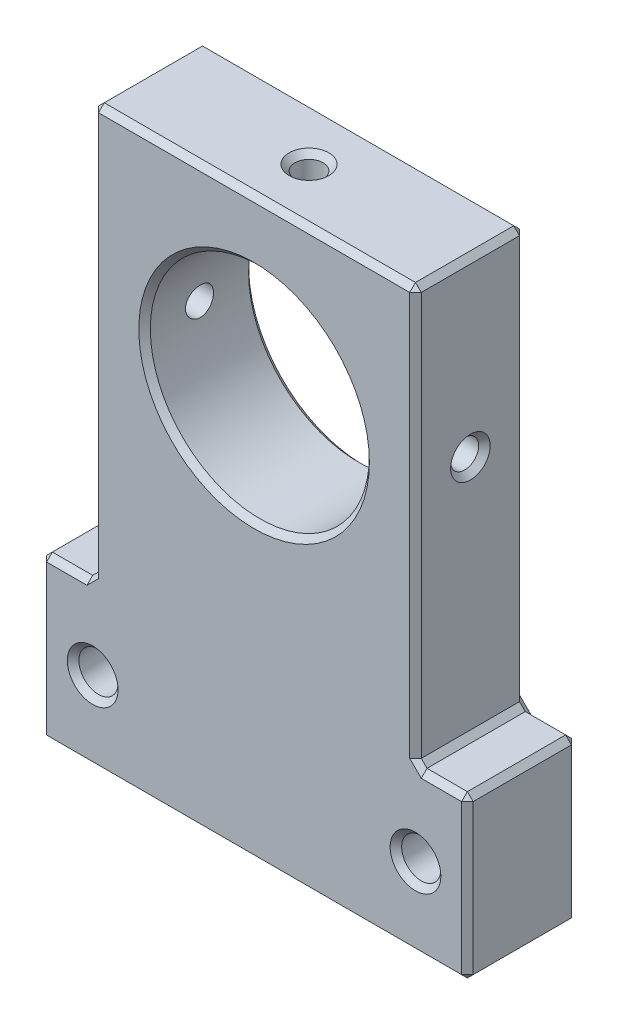
from build123d import *

# Parameters (mm, degrees)
SKETCH1_R               = 9.5
SKETCH1_R_2             = 1.7
BOSS_EXTRUDE1_DEPTH     = 9.525
SKETCH2_R               = 3.25
CUT_EXTRUDE1_DEPTH      = 5.5
SKETCH3_R               = 1.2195
CUT_EXTRUDE2_DEPTH      = 61.390194775
CUT_EXTRUDE3_REACH      = 64.926
CUT_EXTRUDE3_END_RADIUS = 9.5
SKETCH4_R               = 1.2195
CHAMFER1_SIZE           = 0.5
CHAMFER2_SIZE           = 0.5
CHAMFER3_SIZE           = 0.5
CHAMFER4_SIZE           = 0.5


with BuildPart() as part:
    # Sketch1 → Boss-Extrude1 (new body)
    with BuildSketch(Plane(origin=(0, 0, 0), x_dir=(-1, 0, 0), z_dir=(0, 0, 1))):
        Polygon((-37, 0), (-37, -14), (-32.5, -14), (-32.5, -50), (-4.5, -50), (-4.5, -14), (0, -14), (0, 0), align=None)
        with Locations((-18.5, -35)):
            Circle(SKETCH1_R, mode=Mode.SUBTRACT)
        with Locations((-32.5, -7)):
            Circle(SKETCH1_R_2, mode=Mode.SUBTRACT)
        with Locations((-4.5, -7)):
            Circle(SKETCH1_R_2, mode=Mode.SUBTRACT)
    extrude(amount=BOSS_EXTRUDE1_DEPTH)

    # Sketch2 → Cut-Extrude1 (cut)
    with BuildSketch(Plane(origin=(0, 0, 0), x_dir=(-1, 0, 0), z_dir=(0, 0, -1))):
        with Locations((-32.5, 7)):
            Circle(SKETCH2_R)
        with Locations((-4.5, 7)):
            Circle(SKETCH2_R)
    extrude(amount=-CUT_EXTRUDE1_DEPTH, mode=Mode.SUBTRACT)

    # Sketch3 → Cut-Extrude2 (cut, through all)
    with BuildSketch(Plane.ZY.offset(-4.5)):
        with Locations((4.7625, 35)):
            Circle(SKETCH3_R)
    extrude(amount=-CUT_EXTRUDE2_DEPTH, mode=Mode.SUBTRACT)

    # Cut-Extrude3: up to this cylinder (the profile starts outside it)
    cut_extrude3_end = Plane(origin=(18.5, 35, 4.7625), z_dir=(0, 0, -1)) * Cylinder(CUT_EXTRUDE3_END_RADIUS, 149.852, mode=Mode.PRIVATE)
    # Sketch4 → Cut-Extrude3 (cut, up to the surface)
    with BuildSketch(Plane(origin=(0, 50, 0), x_dir=(1, 0, 0), z_dir=(0, 1, 0)), mode=Mode.PRIVATE) as cut_extrude3_sk1:
        with Locations((18.5, -4.7625)):
            Circle(SKETCH4_R)
    cut_extrude3_tool1 = extrude(cut_extrude3_sk1.sketch, amount=-CUT_EXTRUDE3_REACH, mode=Mode.PRIVATE) - cut_extrude3_end
    add(cut_extrude3_tool1.solids().sort_by_distance((18.5, 50, 4.7625))[0], mode=Mode.SUBTRACT)

    # Chamfer1
    chamfer1_edges = [part.edges().sort_by_distance(p)[0] for p in [
        (18.5, 0, 9.525),
        (37, 0, 4.7625),
        (37, 7, 9.525),
        (34.75, 14, 9.525),
        (37, 14, 4.7625),
        (32.5, 32, 9.525),
        (32.5, 14, 4.7625),
        (32.5, 50, 4.7625),
        (18.5, 50, 9.525),
        (4.5, 50, 4.7625),
        (4.5, 32, 9.525),
        (2.25, 14, 9.525),
        (4.5, 14, 4.7625),
        (0, 7, 9.525),
        (0, 0, 4.7625),
        (0, 14, 4.7625),
        (0, 7, 0),
        (2.25, 14, 0),
        (4.5, 32, 0),
        (18.5, 50, 0),
        (32.5, 32, 0),
        (34.75, 14, 0),
        (37, 7, 0),
        (18.5, 0, 0),
        (35.75, 7, 0),
        (7.75, 7, 0),
    ]]
    chamfer(chamfer1_edges, length=CHAMFER1_SIZE)

    # Chamfer2
    chamfer2_edges = [part.edges().sort_by_distance(p)[0] for p in [
        (17.2805, 50, 4.7625),
        (4.5, 35, 3.543),
        (28, 35, 9.525),
        (28, 35, 0),
    ]]
    chamfer(chamfer2_edges, length=CHAMFER2_SIZE)

    # Chamfer3
    chamfer3_edges = [part.edges().sort_by_distance(p)[0] for p in [
        (32.5, 35, 3.543),
    ]]
    chamfer(chamfer3_edges, length=CHAMFER3_SIZE)

    # Chamfer4
    chamfer4_edges = [part.edges().sort_by_distance(p)[0] for p in [
        (6.2, 7, 9.525),
        (34.2, 7, 9.525),
    ]]
    chamfer(chamfer4_edges, length=CHAMFER4_SIZE)


solid = part.part
